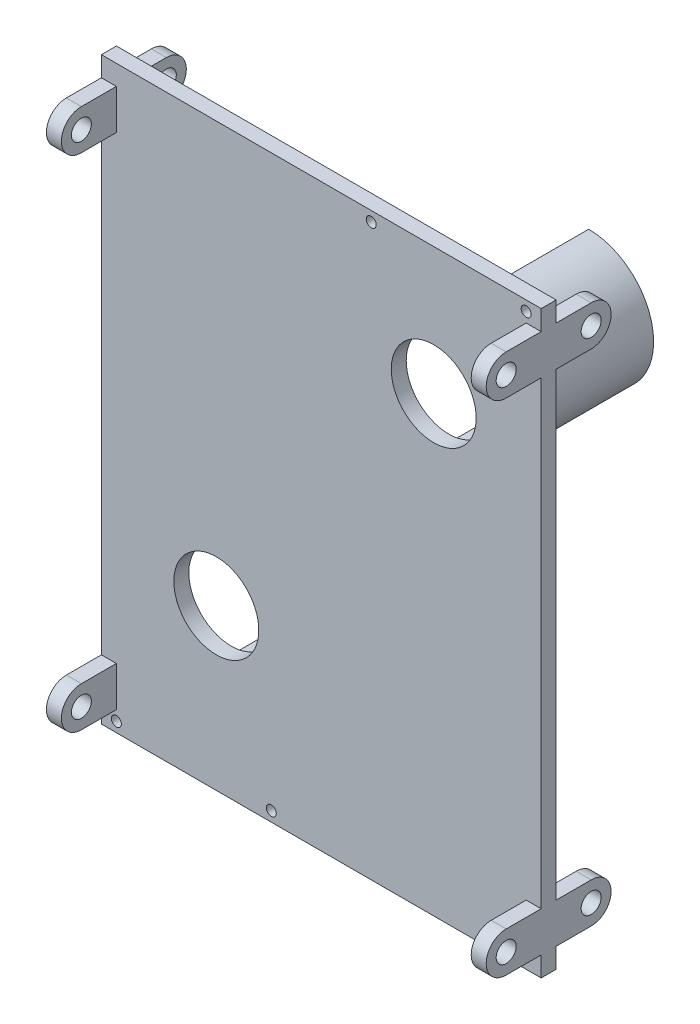
from build123d import *

# Parameters (mm, degrees)
SKETCH1_W           = 88
SKETCH1_H           = 116
BOSS_EXTRUDE1_DEPTH = 3
SKETCH2_R           = 8.5
CUT_EXTRUDE1_DEPTH  = 73.862884928
SKETCH4_R           = 2
BOSS_EXTRUDE3_DEPTH = 3
SKETCH6_R           = 1
CUT_EXTRUDE2_DEPTH  = 10
BOSS_EXTRUDE4_DEPTH = 28


with BuildPart() as part:
    # Sketch1 → Boss-Extrude1 (new body)
    with BuildSketch(Plane.XY):
        Rectangle(SKETCH1_W, SKETCH1_H)
    extrude(amount=BOSS_EXTRUDE1_DEPTH)

    # Sketch2 → Cut-Extrude1 (cut, through all)
    with BuildSketch(Plane.XY.offset(3)):
        with Locations((-22.5, 32.5)):
            Circle(SKETCH2_R)
        with Locations((21, -26)):
            Circle(SKETCH2_R)
    extrude(amount=-CUT_EXTRUDE1_DEPTH, mode=Mode.SUBTRACT)

    # Sketch4 → Boss-Extrude3 (add)
    # profile 1 of 4: a face of its own
    with BuildSketch(Plane.ZY.offset(44)):
        with BuildLine():
            Line((-7, 54), (0, 54))
            Line((0, 54), (0, 46))
            Line((0, 46), (-7, 46))
            ThreePointArc((-7, 46), (-11, 50), (-7, 54))
        make_face()
        with Locations((-7, 50)):
            Circle(SKETCH4_R, mode=Mode.SUBTRACT)
    # profile 2 of 4: a face of its own
    with BuildSketch(Plane.ZY.offset(44)):
        with BuildLine():
            Line((0, -46), (-7, -46))
            ThreePointArc((-7, -46), (-11, -50), (-7, -54))
            Line((-7, -54), (0, -54))
            Line((0, -54), (0, -46))
        make_face()
        with Locations((-7, -50)):
            Circle(SKETCH4_R, mode=Mode.SUBTRACT)
    # profile 3 of 4: a face of its own
    with BuildSketch(Plane.ZY.offset(44)):
        with BuildLine():
            Line((3, 46), (10, 46))
            ThreePointArc((10, 46), (14, 50), (10, 54))
            Line((10, 54), (3, 54))
            Line((3, 54), (3, 46))
        make_face()
        with Locations((10, 50)):
            Circle(SKETCH4_R, mode=Mode.SUBTRACT)
    # profile 4 of 4: a face of its own
    with BuildSketch(Plane.ZY.offset(44)):
        with BuildLine():
            Line((10, -54), (3, -54))
            Line((3, -54), (3, -46))
            Line((3, -46), (10, -46))
            ThreePointArc((10, -46), (14, -50), (10, -54))
        make_face()
        with Locations((10, -50)):
            Circle(SKETCH4_R, mode=Mode.SUBTRACT)
    boss_extrude3 = extrude(amount=-BOSS_EXTRUDE3_DEPTH)

    # Sketch6 → Cut-Extrude2 (cut)
    with BuildSketch(Plane.XY.offset(3)):
        with Locations((-41, 56)):
            Circle(SKETCH6_R)
        with Locations((-10, 56)):
            Circle(SKETCH6_R)
        with Locations((41, -56)):
            Circle(SKETCH6_R)
        with Locations((10, -56)):
            Circle(SKETCH6_R)
    extrude(amount=-CUT_EXTRUDE2_DEPTH, mode=Mode.SUBTRACT)

    # Sketch5 → Boss-Extrude4 (add)
    with BuildSketch(Plane(origin=(0, 0, 0), x_dir=(-1, 0, 0), z_dir=(0, 0, -1))):
        with BuildLine():
            Line((22.5, 45.5), (22.5, 42.5))
            ThreePointArc((22.5, 42.5), (32.5, 32.5), (22.5, 22.5))
            Line((22.5, 22.5), (22.5, 19.5))
            ThreePointArc((22.5, 19.5), (35.5, 32.5), (22.5, 45.5))
        make_face()
        with BuildLine():
            Line((-21, -13), (-21, -16))
            ThreePointArc((-21, -16), (-11, -26), (-21, -36))
            Line((-21, -36), (-21, -39))
            ThreePointArc((-21, -39), (-8, -26), (-21, -13))
        make_face()
    extrude(amount=BOSS_EXTRUDE4_DEPTH)

    # Mirror1: Boss-Extrude3 across plane
    add(boss_extrude3.mirror(Plane(origin=(0, 0, 0), x_dir=(0, 0, 1), z_dir=(1, 0, 0))))


with BuildPart() as body_2:
    # Mirror2: mirrored copy
    add(part.part.mirror(Plane(origin=(44, -58, 3), x_dir=(0, 0, 1), z_dir=(-1, 0, 0))))


solid = body_2.part
